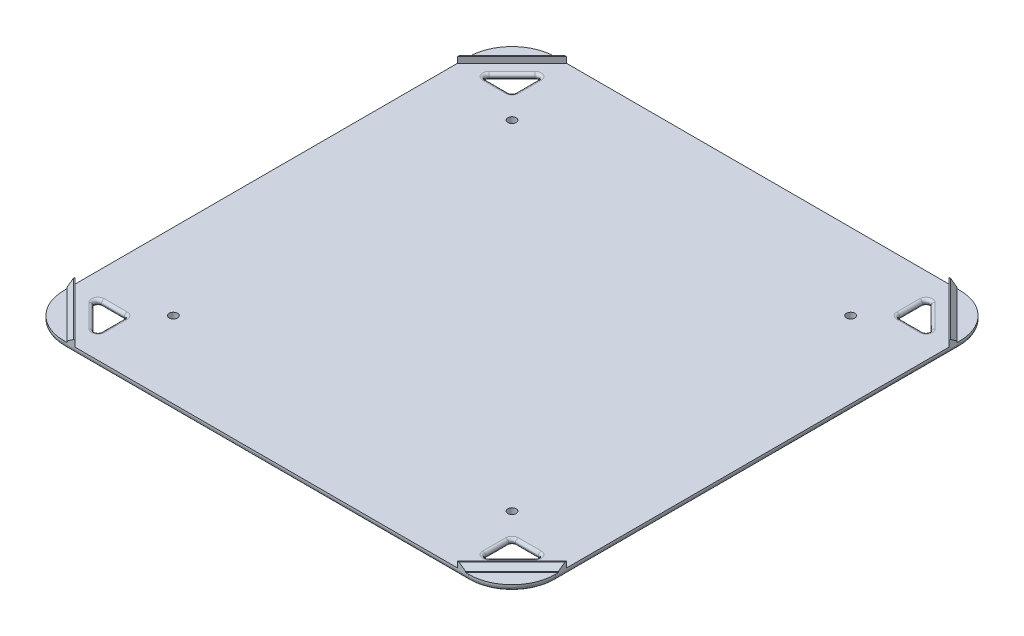
from build123d import *

# Parameters (mm, degrees)
SKETCH1_W           = 269.24
SKETCH1_H           = 269.24
BOSS_EXTRUDE1_DEPTH = 3.175
FILLET1_R           = 23.8125
FILLET2_R           = 1.905
BOSS_EXTRUDE2_DEPTH = 3.175
CUT_EXTRUDE4_REACH  = 192.408
SKETCH8_R           = 2.286
CHAMFER1_SIZE       = 2.54
CUT_EXTRUDE5_REACH  = 192.408
FILLET3_R           = 1.905
FILLET4_R           = 1.5875
FILLET5_R           = 1.5875


with BuildPart() as part:
    # Sketch1 → Boss-Extrude1 (new body)
    with BuildSketch(Plane(origin=(0, 0, 0), x_dir=(1, 0, 0), z_dir=(0, 1, 0))):
        Rectangle(SKETCH1_W, SKETCH1_H)
    extrude(amount=BOSS_EXTRUDE1_DEPTH)

    # Fillet1
    fillet1_edges = [part.edges().sort_by_distance(p)[0] for p in [
        (134.62, 1.5875, 134.62),
        (-134.62, 1.5875, 134.62),
        (-134.62, 1.5875, -134.62),
        (134.62, 1.5875, -134.62),
    ]]
    fillet(fillet1_edges, radius=FILLET1_R)

    # Fillet2
    fillet2_edges = [part.edges().sort_by_distance(p)[0] for p in [
        (134.62, 0, 0),
        (0, 0, 134.62),
        (-134.62, 0, 0),
        (0, 0, -134.62),
        (-127.645480227, 0, 127.645480227),
        (-127.645480227, 0, -127.645480227),
        (127.645480227, 0, -127.645480227),
        (127.645480227, 0, 127.645480227),
    ]]
    fillet(fillet2_edges, radius=FILLET2_R)

    # Sketch9 → Boss-Extrude2 (add)
    with BuildSketch(Plane(origin=(0, 3.175, 0), x_dir=(1, 0, 0), z_dir=(0, 1, 0))):
        Polygon((-134.62, 104.729871939), (-104.729871939, 134.62), (-109.22, 134.62), (-134.62, 109.22), align=None)
        Polygon((104.729871939, 134.62), (134.62, 104.729871939), (134.62, 109.22), (109.22, 134.62), align=None)
        Polygon((-109.22, -134.62), (-134.62, -109.22), (-134.62, -104.729871939), (-104.729871939, -134.62), align=None)
        Polygon((104.729871939, -134.62), (134.62, -104.729871939), (134.62, -109.22), (109.22, -134.62), align=None)
    extrude(amount=BOSS_EXTRUDE2_DEPTH)

    # Sketch8 → Cut-Extrude4 (cut, up to next)
    with BuildSketch(Plane(origin=(0, 3.175, 0), x_dir=(1, 0, 0), z_dir=(0, 1, 0)), mode=Mode.PRIVATE) as cut_extrude4_sk1:
        with Locations(Location((-92.734167607, -92.734167607, 0), (0, 0, 270))):
            Circle(SKETCH8_R)
    cut_extrude4_tool1 = extrude(cut_extrude4_sk1.sketch, amount=-CUT_EXTRUDE4_REACH, mode=Mode.PRIVATE) & part.part
    # Sketch8 → Cut-Extrude4 (cut, up to next)
    with BuildSketch(Plane(origin=(0, 3.175, 0), x_dir=(1, 0, 0), z_dir=(0, 1, 0)), mode=Mode.PRIVATE) as cut_extrude4_sk2:
        with Locations(Location((92.734167607, -92.734167607, 0), (0, 0, 270))):
            Circle(SKETCH8_R)
    cut_extrude4_tool2 = extrude(cut_extrude4_sk2.sketch, amount=-CUT_EXTRUDE4_REACH, mode=Mode.PRIVATE) & part.part
    # Sketch8 → Cut-Extrude4 (cut, up to next)
    with BuildSketch(Plane(origin=(0, 3.175, 0), x_dir=(1, 0, 0), z_dir=(0, 1, 0)), mode=Mode.PRIVATE) as cut_extrude4_sk3:
        with Locations(Location((-92.734167607, 92.734167607, 0), (0, 0, 270))):
            Circle(SKETCH8_R)
    cut_extrude4_tool3 = extrude(cut_extrude4_sk3.sketch, amount=-CUT_EXTRUDE4_REACH, mode=Mode.PRIVATE) & part.part
    # Sketch8 → Cut-Extrude4 (cut, up to next)
    with BuildSketch(Plane(origin=(0, 3.175, 0), x_dir=(1, 0, 0), z_dir=(0, 1, 0)), mode=Mode.PRIVATE) as cut_extrude4_sk4:
        with Locations(Location((92.734167607, 92.734167607, 0), (0, 0, 270))):
            Circle(SKETCH8_R)
    cut_extrude4_tool4 = extrude(cut_extrude4_sk4.sketch, amount=-CUT_EXTRUDE4_REACH, mode=Mode.PRIVATE) & part.part
    add(cut_extrude4_tool1.solids().sort_by_distance((-92.734168, 3.175, 92.734168))[0], mode=Mode.SUBTRACT)
    add(cut_extrude4_tool2.solids().sort_by_distance((92.734168, 3.175, 92.734168))[0], mode=Mode.SUBTRACT)
    add(cut_extrude4_tool3.solids().sort_by_distance((-92.734168, 3.175, -92.734168))[0], mode=Mode.SUBTRACT)
    add(cut_extrude4_tool4.solids().sort_by_distance((92.734168, 3.175, -92.734168))[0], mode=Mode.SUBTRACT)

    # Chamfer1
    chamfer1_edges = [part.edges().sort_by_distance(p)[0] for p in [
        (121.92, 6.35, 121.92),
        (-121.92, 6.35, -121.92),
        (121.92, 6.35, -121.92),
        (-121.92, 6.35, 121.92),
    ]]
    chamfer(chamfer1_edges, length=CHAMFER1_SIZE)

    # Sketch10 → Cut-Extrude5 (cut, up to next)
    with BuildSketch(Plane(origin=(0, 3.175, 0), x_dir=(1, 0, 0), z_dir=(0, 1, 0)), mode=Mode.PRIVATE) as cut_extrude5_sk1:
        Polygon((-124.260795103, -105.210795103), (-105.210795103, -124.260795103), (-105.210795103, -105.210795103), align=None)
    cut_extrude5_tool1 = extrude(cut_extrude5_sk1.sketch, amount=-CUT_EXTRUDE5_REACH, mode=Mode.PRIVATE) & part.part
    # Sketch10 → Cut-Extrude5 (cut, up to next)
    with BuildSketch(Plane(origin=(0, 3.175, 0), x_dir=(1, 0, 0), z_dir=(0, 1, 0)), mode=Mode.PRIVATE) as cut_extrude5_sk2:
        Polygon((-105.210795103, 105.210795103), (-105.210795103, 124.260795103), (-124.260795103, 105.210795103), align=None)
    cut_extrude5_tool2 = extrude(cut_extrude5_sk2.sketch, amount=-CUT_EXTRUDE5_REACH, mode=Mode.PRIVATE) & part.part
    # Sketch10 → Cut-Extrude5 (cut, up to next)
    with BuildSketch(Plane(origin=(0, 3.175, 0), x_dir=(1, 0, 0), z_dir=(0, 1, 0)), mode=Mode.PRIVATE) as cut_extrude5_sk3:
        Polygon((105.210795103, 105.210795103), (124.260795103, 105.210795103), (105.210795103, 124.260795103), align=None)
    cut_extrude5_tool3 = extrude(cut_extrude5_sk3.sketch, amount=-CUT_EXTRUDE5_REACH, mode=Mode.PRIVATE) & part.part
    # Sketch10 → Cut-Extrude5 (cut, up to next)
    with BuildSketch(Plane(origin=(0, 3.175, 0), x_dir=(1, 0, 0), z_dir=(0, 1, 0)), mode=Mode.PRIVATE) as cut_extrude5_sk4:
        Polygon((105.210795103, -105.210795103), (105.210795103, -124.260795103), (124.260795103, -105.210795103), align=None)
    cut_extrude5_tool4 = extrude(cut_extrude5_sk4.sketch, amount=-CUT_EXTRUDE5_REACH, mode=Mode.PRIVATE) & part.part
    add(cut_extrude5_tool1.solids().sort_by_distance((-111.560795, 3.175, 111.560795))[0], mode=Mode.SUBTRACT)
    add(cut_extrude5_tool2.solids().sort_by_distance((-111.560795, 3.175, -111.560795))[0], mode=Mode.SUBTRACT)
    add(cut_extrude5_tool3.solids().sort_by_distance((111.560795, 3.175, -111.560795))[0], mode=Mode.SUBTRACT)
    add(cut_extrude5_tool4.solids().sort_by_distance((111.560795, 3.175, 111.560795))[0], mode=Mode.SUBTRACT)

    # Fillet3
    fillet3_edges = [part.edges().sort_by_distance(p)[0] for p in [
        (105.210795103, 1.5875, 124.260795103),
        (105.210795103, 1.5875, 105.210795103),
        (124.260795103, 1.5875, 105.210795103),
        (124.260795103, 1.5875, -105.210795103),
        (105.210795103, 1.5875, -105.210795103),
        (105.210795103, 1.5875, -124.260795103),
        (-105.210795103, 1.5875, -124.260795103),
        (-105.210795103, 1.5875, -105.210795103),
        (-124.260795103, 1.5875, -105.210795103),
        (-105.210795103, 1.5875, 124.260795103),
        (-124.260795103, 1.5875, 105.210795103),
        (-105.210795103, 1.5875, 105.210795103),
    ]]
    fillet(fillet3_edges, radius=FILLET3_R)

    # Fillet4
    fillet4_edges = [part.edges().sort_by_distance(p)[0] for p in [
        (105.210795103, 0, 113.388756685),
        (113.388756685, 0, 105.210795103),
        (114.735795103, 0, 114.735795103),
        (105.210795103, 0, -113.388756685),
        (114.735795103, 0, -114.735795103),
        (113.388756685, 0, -105.210795103),
        (-114.735795103, 0, -114.735795103),
        (-105.210795103, 0, -113.388756685),
        (-113.388756685, 0, -105.210795103),
        (-113.388756685, 0, 105.210795103),
        (-105.210795103, 0, 113.388756685),
        (-114.735795103, 0, 114.735795103),
        (105.768756685, 0, 105.768756685),
        (121.421708776, 0, 106.386783164),
        (106.386783164, 0, 121.421708776),
        (106.386783164, 0, -121.421708776),
        (121.421708776, 0, -106.386783164),
        (105.768756685, 0, -105.768756685),
        (-106.386783164, 0, -121.421708776),
        (-105.768756685, 0, -105.768756685),
        (-121.421708776, 0, -106.386783164),
        (-105.768756685, 0, 105.768756685),
        (-106.386783164, 0, 121.421708776),
        (-121.421708776, 0, 106.386783164),
    ]]
    fillet(fillet4_edges, radius=FILLET4_R)

    # Fillet5
    fillet5_edges = [part.edges().sort_by_distance(p)[0] for p in [
        (105.768756685, 3.175, 105.768756685),
        (113.388756685, 3.175, 105.210795103),
        (121.421708776, 3.175, 106.386783164),
        (114.735795103, 3.175, 114.735795103),
        (106.386783164, 3.175, 121.421708776),
        (105.768756685, 3.175, -105.768756685),
        (105.210795103, 3.175, -113.388756685),
        (106.386783164, 3.175, -121.421708776),
        (114.735795103, 3.175, -114.735795103),
        (121.421708776, 3.175, -106.386783164),
        (-121.421708776, 3.175, -106.386783164),
        (-114.735795103, 3.175, -114.735795103),
        (-106.386783164, 3.175, -121.421708776),
        (-105.210795103, 3.175, -113.388756685),
        (-105.768756685, 3.175, -105.768756685),
        (-121.421708776, 3.175, 106.386783164),
        (-113.388756685, 3.175, 105.210795103),
        (-105.768756685, 3.175, 105.768756685),
        (-105.210795103, 3.175, 113.388756685),
        (-106.386783164, 3.175, 121.421708776),
        (105.210795103, 3.175, 113.388756685),
        (113.388756685, 3.175, -105.210795103),
        (-113.388756685, 3.175, -105.210795103),
        (-114.735795103, 3.175, 114.735795103),
    ]]
    fillet(fillet5_edges, radius=FILLET5_R - 0.0001)  # a hair under: the kernel refuses the full size


solid = part.part
